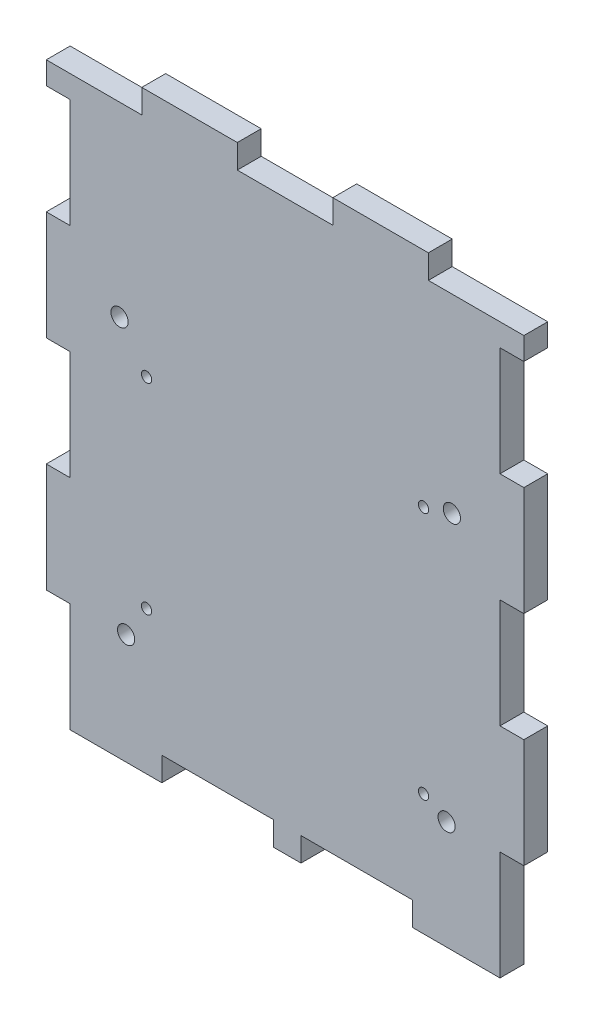
from build123d import *

# Parameters (mm, degrees)
SKETCH1_W               = 88.9
SKETCH1_H               = 203.2
BOSS_EXTRUDE1_DEPTH     = 6.35
SKETCH3_W               = 29.633333334
SKETCH3_H               = 6.35
CUT_EXTRUDE2_DEPTH      = 112.079633597
CAVITY2_START           = -101.6
CAVITY2_OUTLINE_W       = 6.35
CAVITY2_OUTLINE_H       = 6.35
CAVITY2_DEPTH           = 29.028571429
CAVITY2_START_2         = -43.542857143
CAVITY2_2_OUTLINE_W     = 6.35
CAVITY2_2_OUTLINE_H     = 6.35
CAVITY2_2_DEPTH         = 29.028571429
CAVITY2_START_3         = 14.514285714
CAVITY2_3_OUTLINE_W     = 6.35
CAVITY2_3_OUTLINE_H     = 6.35
CAVITY2_3_DEPTH         = 29.028571429
CUT_EXTRUDE3_DEPTH      = 112.079633597
SKETCH5_W               = 38.1
SKETCH5_H               = 163.83
BOSS_EXTRUDE2_DEPTH     = 6.35
CAVITY3_START           = 49.53
CAVITY3_OUTLINE_W       = 25.4
CAVITY3_OUTLINE_H       = 6.35
CAVITY3_DEPTH           = 6.35
CAVITY3_START_2         = -101.6
CAVITY3_2_OUTLINE_W     = 6.35
CAVITY3_2_OUTLINE_H     = 6.35
CAVITY3_2_DEPTH         = 29.028571429
CAVITY3_START_3         = -43.542857143
CAVITY3_3_OUTLINE_W     = 6.35
CAVITY3_3_OUTLINE_H     = 6.35
CAVITY3_3_DEPTH         = 29.028571429
CAVITY3_START_4         = 14.514285714
CAVITY3_4_OUTLINE_W     = 6.35
CAVITY3_4_OUTLINE_H     = 6.35
CAVITY3_4_DEPTH         = 29.028571429
SKETCH7_W               = 127
SKETCH7_H               = 6.35
CUT_EXTRUDE4_DEPTH      = 132.062523247
CUT_EXTRUDE5_DEPTH      = 132.062523247
CUT_EXTRUDE5_DEPTH_BACK = 132.062523247
SKETCH9_R               = 1.3716
CUT_EXTRUDE6_DEPTH      = 132.062523247
SKETCH10_R              = 2.286
CUT_EXTRUDE8_DEPTH      = 132.062523247


# Read off the part's stored shape, not the designer's step: Cavity2, Cavity3
with BuildPart() as part:
    # Sketch1 → Boss-Extrude1 (new body)
    with BuildSketch(Plane.XY):
        Rectangle(SKETCH1_W, SKETCH1_H)
    extrude(amount=BOSS_EXTRUDE1_DEPTH)

    # Sketch3 → Cut-Extrude2 (cut, through all)
    with BuildSketch(Plane(origin=(0, 0, 0), x_dir=(-1, 0, 0), z_dir=(0, 0, -1))):
        with Locations((0, -98.425)):
            Rectangle(SKETCH3_W, SKETCH3_H)
    extrude(amount=-CUT_EXTRUDE2_DEPTH, mode=Mode.SUBTRACT)

    # Cavity2 outline → Cavity2 (cut)
    with BuildSketch(Plane(origin=(0, 0, 0), x_dir=(1, 0, 0), z_dir=(0, 1, 0)).offset(CAVITY2_START)):
        with Locations((41.275, -3.175)):
            Rectangle(CAVITY2_OUTLINE_W, CAVITY2_OUTLINE_H)
    extrude(amount=CAVITY2_DEPTH, mode=Mode.SUBTRACT)

    # Cavity2 2 outline → Cavity2 2 (cut)
    with BuildSketch(Plane(origin=(0, 0, 0), x_dir=(1, 0, 0), z_dir=(0, 1, 0)).offset(CAVITY2_START_2)):
        with Locations((41.275, -3.175)):
            Rectangle(CAVITY2_2_OUTLINE_W, CAVITY2_2_OUTLINE_H)
    extrude(amount=CAVITY2_2_DEPTH, mode=Mode.SUBTRACT)

    # Cavity2 3 outline → Cavity2 3 (cut)
    with BuildSketch(Plane(origin=(0, 0, 0), x_dir=(1, 0, 0), z_dir=(0, 1, 0)).offset(CAVITY2_START_3)):
        with Locations((41.275, -3.175)):
            Rectangle(CAVITY2_3_OUTLINE_W, CAVITY2_3_OUTLINE_H)
    extrude(amount=CAVITY2_3_DEPTH, mode=Mode.SUBTRACT)

    # Sketch4 → Cut-Extrude3 (cut, through all)
    with BuildSketch(Plane(origin=(0, 0, 0), x_dir=(-1, 0, 0), z_dir=(0, 0, -1))):
        Polygon((0, 62.23), (44.45, 62.23), (44.45, 101.6), (-44.45, 101.6), (-44.45, 62.23), align=None)
    extrude(amount=-CUT_EXTRUDE3_DEPTH, mode=Mode.SUBTRACT)

    # Sketch5 → Boss-Extrude2 (add, through all)
    with BuildSketch(Plane(origin=(0, 0, 0), x_dir=(-1, 0, 0), z_dir=(0, 0, -1))):
        with Locations((63.5, -19.685)):
            Rectangle(SKETCH5_W, SKETCH5_H)
    extrude(amount=-BOSS_EXTRUDE2_DEPTH)

    # Cavity3 outline → Cavity3 (cut)
    with BuildSketch(Plane(origin=(0, 0, 0), x_dir=(1, 0, 0), z_dir=(0, 1, 0)).offset(CAVITY3_START)):
        with Locations((-69.85, -3.175)):
            Rectangle(CAVITY3_OUTLINE_W, CAVITY3_OUTLINE_H)
        with Locations((-19.05, -3.175)):
            Rectangle(CAVITY3_OUTLINE_W, CAVITY3_OUTLINE_H)
        with Locations((31.75, -3.175)):
            Rectangle(CAVITY3_OUTLINE_W, CAVITY3_OUTLINE_H)
    extrude(amount=CAVITY3_DEPTH, mode=Mode.SUBTRACT)

    # Cavity3 2 outline → Cavity3 2 (cut)
    with BuildSketch(Plane(origin=(0, 0, 0), x_dir=(1, 0, 0), z_dir=(0, 1, 0)).offset(CAVITY3_START_2)):
        with Locations((-79.375, -3.175)):
            Rectangle(CAVITY3_2_OUTLINE_W, CAVITY3_2_OUTLINE_H)
    extrude(amount=CAVITY3_2_DEPTH, mode=Mode.SUBTRACT)

    # Cavity3 3 outline → Cavity3 3 (cut)
    with BuildSketch(Plane(origin=(0, 0, 0), x_dir=(1, 0, 0), z_dir=(0, 1, 0)).offset(CAVITY3_START_3)):
        with Locations((-79.375, -3.175)):
            Rectangle(CAVITY3_3_OUTLINE_W, CAVITY3_3_OUTLINE_H)
    extrude(amount=CAVITY3_3_DEPTH, mode=Mode.SUBTRACT)

    # Cavity3 4 outline → Cavity3 4 (cut)
    with BuildSketch(Plane(origin=(0, 0, 0), x_dir=(1, 0, 0), z_dir=(0, 1, 0)).offset(CAVITY3_START_4)):
        with Locations((-79.375, -3.175)):
            Rectangle(CAVITY3_4_OUTLINE_W, CAVITY3_4_OUTLINE_H)
    extrude(amount=CAVITY3_4_DEPTH, mode=Mode.SUBTRACT)

    # Sketch7 → Cut-Extrude4 (cut, through all)
    with BuildSketch(Plane(origin=(0, 0, 0), x_dir=(-1, 0, 0), z_dir=(0, 0, -1))):
        with Locations((19.05, 59.055)):
            Rectangle(SKETCH7_W, SKETCH7_H)
    extrude(amount=-CUT_EXTRUDE4_DEPTH, mode=Mode.SUBTRACT)

    # Sketch8 → Cut-Extrude5 (cut, two sides: drawn at the far end of the back side and taken through both)
    with BuildSketch(Plane(origin=(0, 0, 0), x_dir=(-1, 0, 0), z_dir=(0, 0, -1)).offset(-CUT_EXTRUDE5_DEPTH_BACK)):
        Polygon((51.816, -480.745462689), (51.816, -101.6), (51.816, -95.25), (22.098, -95.25), (22.098, -101.6), (22.098, -480.745462689), (22.098, -1239.036388068), (51.816, -1239.036388068), align=None)
    extrude(amount=CUT_EXTRUDE5_DEPTH + CUT_EXTRUDE5_DEPTH_BACK, mode=Mode.SUBTRACT)

    # Sketch9 → Cut-Extrude6 (cut, through all)
    with BuildSketch(Plane.XY.offset(6.35)):
        with Locations((-55.88, -63.5)):
            Circle(SKETCH9_R)
        with Locations((17.78, -69.342)):
            Circle(SKETCH9_R)
        with Locations((-55.88, -10.16)):
            Circle(SKETCH9_R)
        with Locations((17.78, -3.302)):
            Circle(SKETCH9_R)
    extrude(amount=-CUT_EXTRUDE6_DEPTH, mode=Mode.SUBTRACT)

    # Sketch10 → Cut-Extrude8 (cut, through all)
    with BuildSketch(Plane(origin=(0, 0, 0), x_dir=(-1, 0, 0), z_dir=(0, 0, -1))):
        with Locations((61.309312367, -72.22311472)):
            Circle(SKETCH10_R)
        with Locations((63.059030347, 0.028511897)):
            Circle(SKETCH10_R)
        with Locations((-23.90939041, -72.710988475)):
            Circle(SKETCH10_R)
        with Locations((-25.303227794, -0.994316453)):
            Circle(SKETCH10_R)
    extrude(amount=-CUT_EXTRUDE8_DEPTH, mode=Mode.SUBTRACT)


solid = part.part
